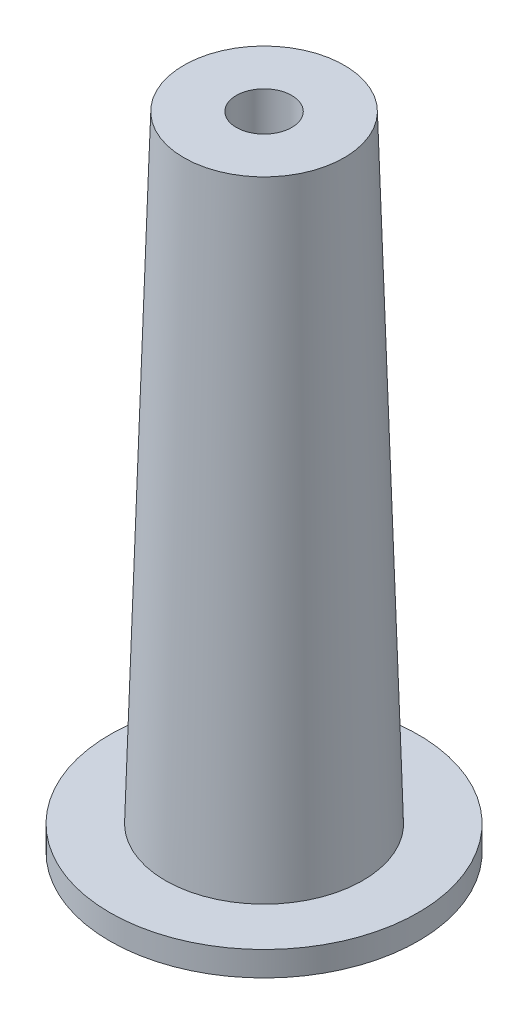
from build123d import *

# Parameters (mm, degrees)
ESQUISSE1_R                  = 25
BOSS_EXTRU_1_DEPTH           = 4
ENL_V_MAT_EXTRU_1_DEPTH      = 107.066017178
ENL_V_MAT_EXTRU_1_DEPTH_BACK = 107.066017178
ESQUISSE2_R                  = 4.5


with BuildPart() as part:
    # Esquisse1 → Boss.-Extru.1 (new body)
    with BuildSketch(Plane(origin=(0, 0, 0), x_dir=(1, 0, 0), z_dir=(0, 1, 0))):
        Circle(ESQUISSE1_R)
    extrude(amount=BOSS_EXTRU_1_DEPTH)

    # Esquisse3 → Révolution1 (revolve)
    with BuildSketch(Plane(origin=(0, 0, 0), x_dir=(0, 0, -1), z_dir=(1, 0, 0))):
        Polygon((0, 4), (-16, 4), (-13, 104), (0, 104), align=None)
    revolve(axis=Axis((0, 104, 0), (0, -1, 0)))

    # Esquisse2 → Enlèv. mat.-Extru.1 (cut, two sides: drawn at the far end of the back side and taken through both)
    with BuildSketch(Plane(origin=(0, 4, 0), x_dir=(1, 0, 0), z_dir=(0, 1, 0)).offset(-ENL_V_MAT_EXTRU_1_DEPTH_BACK)):
        Circle(ESQUISSE2_R)
    extrude(amount=ENL_V_MAT_EXTRU_1_DEPTH + ENL_V_MAT_EXTRU_1_DEPTH_BACK, mode=Mode.SUBTRACT)


solid = part.part
